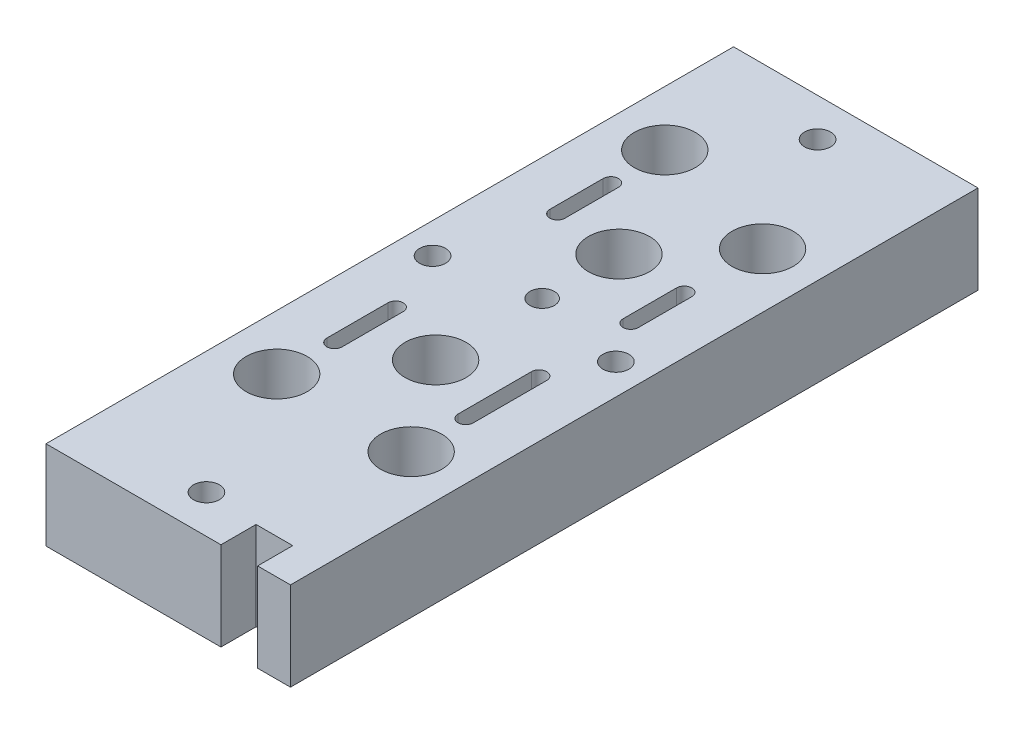
from build123d import *

# Parameters (mm, degrees)
SKETCH1_W           = 80
SKETCH1_H           = 225
BOSS_EXTRUDE1_DEPTH = 29
CUT_EXTRUDE1_REACH  = 124.871
SKETCH4_R           = 10
CUT_EXTRUDE2_DEPTH  = 20
SKETCH5_R           = 8.5
CUT_EXTRUDE3_DEPTH  = 5
CUT_EXTRUDE4_REACH  = 124.871
SKETCH6_W           = 12
SKETCH6_H           = 11.5
M10_TAPPED_HOLE1_D  = 8.5
CUT_EXTRUDE5_REACH  = 124.871
SKETCH10_R          = 4


with BuildPart() as part:
    # Sketch1 → Boss-Extrude1 (new body)
    with BuildSketch(Plane(origin=(0, 0, 0), x_dir=(1, 0, 0), z_dir=(0, 1, 0))):
        Rectangle(SKETCH1_W, SKETCH1_H)
    extrude(amount=-BOSS_EXTRUDE1_DEPTH)

    # Sketch2 → Cut-Extrude1 (cut, up to next)
    with BuildSketch(Plane(origin=(0, 0, 0), x_dir=(1, 0, 0), z_dir=(0, 1, 0)), mode=Mode.PRIVATE) as cut_extrude1_sk1:
        with BuildLine():
            Line((-19, 36.36), (-19, 53.86))
            ThreePointArc((-19, 53.86), (-21.5, 56.36), (-24, 53.86))
            Line((-24, 53.86), (-24, 36.36))
            ThreePointArc((-24, 36.36), (-21.5, 33.86), (-19, 36.36))
        make_face()
    cut_extrude1_tool1 = extrude(cut_extrude1_sk1.sketch, amount=-CUT_EXTRUDE1_REACH, mode=Mode.PRIVATE) & part.part
    # Sketch2 → Cut-Extrude1 (cut, up to next)
    with BuildSketch(Plane(origin=(0, 0, 0), x_dir=(1, 0, 0), z_dir=(0, 1, 0)), mode=Mode.PRIVATE) as cut_extrude1_sk2:
        with BuildLine():
            Line((-19, -36.59), (-19, -16.59))
            ThreePointArc((-19, -16.59), (-21.5, -14.09), (-24, -16.59))
            Line((-24, -16.59), (-24, -36.59))
            ThreePointArc((-24, -36.59), (-21.5, -39.09), (-19, -36.59))
        make_face()
    cut_extrude1_tool2 = extrude(cut_extrude1_sk2.sketch, amount=-CUT_EXTRUDE1_REACH, mode=Mode.PRIVATE) & part.part
    # Sketch2 → Cut-Extrude1 (cut, up to next)
    with BuildSketch(Plane(origin=(0, 0, 0), x_dir=(1, 0, 0), z_dir=(0, 1, 0)), mode=Mode.PRIVATE) as cut_extrude1_sk3:
        with BuildLine():
            Line((24, 17.36), (24, 34.86))
            ThreePointArc((24, 34.86), (21.5, 37.36), (19, 34.86))
            Line((19, 34.86), (19, 17.36))
            ThreePointArc((19, 17.36), (21.5, 14.86), (24, 17.36))
        make_face()
    cut_extrude1_tool3 = extrude(cut_extrude1_sk3.sketch, amount=-CUT_EXTRUDE1_REACH, mode=Mode.PRIVATE) & part.part
    # Sketch2 → Cut-Extrude1 (cut, up to next)
    with BuildSketch(Plane(origin=(0, 0, 0), x_dir=(1, 0, 0), z_dir=(0, 1, 0)), mode=Mode.PRIVATE) as cut_extrude1_sk4:
        with BuildLine():
            Line((24, -36.64), (24, -12.64))
            ThreePointArc((24, -12.64), (21.5, -10.14), (19, -12.64))
            Line((19, -12.64), (19, -36.64))
            ThreePointArc((19, -36.64), (21.5, -39.14), (24, -36.64))
        make_face()
    cut_extrude1_tool4 = extrude(cut_extrude1_sk4.sketch, amount=-CUT_EXTRUDE1_REACH, mode=Mode.PRIVATE) & part.part
    add(cut_extrude1_tool1.solids().sort_by_distance((-21.5, 0, -45.11))[0], mode=Mode.SUBTRACT)
    add(cut_extrude1_tool2.solids().sort_by_distance((-21.5, 0, 26.59))[0], mode=Mode.SUBTRACT)
    add(cut_extrude1_tool3.solids().sort_by_distance((21.5, 0, -26.11))[0], mode=Mode.SUBTRACT)
    add(cut_extrude1_tool4.solids().sort_by_distance((21.5, 0, 24.64))[0], mode=Mode.SUBTRACT)

    # Sketch4 → Cut-Extrude2 (cut)
    with BuildSketch(Plane(origin=(0, 0, 0), x_dir=(1, 0, 0), z_dir=(0, 1, 0))):
        with Locations((-22, 72)):
            Circle(SKETCH4_R)
        with Locations((22, 60)):
            Circle(SKETCH4_R)
        with Locations((0, 35)):
            Circle(SKETCH4_R)
        with Locations((0, -25)):
            Circle(SKETCH4_R)
        with Locations((22, -55)):
            Circle(SKETCH4_R)
        with Locations((-22, -55)):
            Circle(SKETCH4_R)
    extrude(amount=-CUT_EXTRUDE2_DEPTH, mode=Mode.SUBTRACT)

    # Sketch5 → Cut-Extrude3 (cut)
    with BuildSketch(Plane.XZ.offset(29)):
        with Locations((0, 100)):
            Circle(SKETCH5_R)
        with Locations((0, -100)):
            Circle(SKETCH5_R)
    extrude(amount=-CUT_EXTRUDE3_DEPTH, mode=Mode.SUBTRACT)

    # Sketch6 → Cut-Extrude4 (cut, up to next)
    with BuildSketch(Plane(origin=(0, 0, 0), x_dir=(1, 0, 0), z_dir=(0, 1, 0)), mode=Mode.PRIVATE) as cut_extrude4_sk1:
        with Locations((23.25, -106.75)):
            Rectangle(SKETCH6_W, SKETCH6_H)
    cut_extrude4_tool1 = extrude(cut_extrude4_sk1.sketch, amount=-CUT_EXTRUDE4_REACH, mode=Mode.PRIVATE) & part.part
    add(cut_extrude4_tool1.solids().sort_by_distance((23.25, 0, 106.75))[0], mode=Mode.SUBTRACT)

    # M10 Tapped Hole1 (through all)
    with Locations(Plane(origin=(0, 0, 0), x_dir=(1, 0, 0), z_dir=(0, 1, 0))):
        with Locations((0, -100), (30, 4), (-30, 4), (0, 100)):
            Hole(M10_TAPPED_HOLE1_D / 2)

    # Sketch10 → Cut-Extrude5 (cut, up to next)
    with BuildSketch(Plane(origin=(0, 0, 0), x_dir=(1, 0, 0), z_dir=(0, 1, 0)), mode=Mode.PRIVATE) as cut_extrude5_sk1:
        with Locations((0, 9.86)):
            Circle(SKETCH10_R)
    cut_extrude5_tool1 = extrude(cut_extrude5_sk1.sketch, amount=-CUT_EXTRUDE5_REACH, mode=Mode.PRIVATE) & part.part
    add(cut_extrude5_tool1.solids().sort_by_distance((0, 0, -9.86))[0], mode=Mode.SUBTRACT)


solid = part.part
